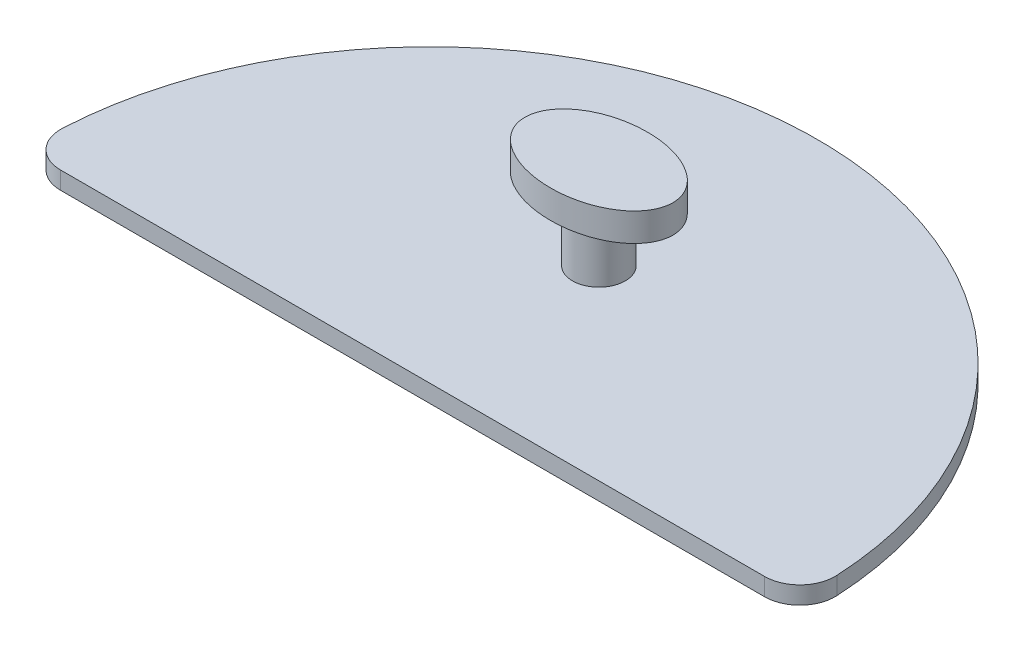
from build123d import *

# Parameters (mm, degrees)
EXTRUDE_1_DEPTH = 5
EXTRUDE_2_DEPTH = 5
SKETCH_3_R      = 7.5
EXTRUDE_3_DEPTH = 18
SKETCH_4_RX     = 21.017833777
SKETCH_4_RY     = 13.757127563
EXTRUDE_4_DEPTH = 8
FILLET_3_R      = 10


with BuildPart() as part:
    # 草图1 → 凸台-拉伸1 (new body)
    with BuildSketch(Plane(origin=(0, 0, 0), x_dir=(1, 0, 0), z_dir=(0, 1, 0))):
        with BuildLine():
            Line((0, 0), (220, 0))
            ThreePointArc((220, 0), (110, 115), (0, 0))
        make_face()
    extrude(amount=EXTRUDE_1_DEPTH)

    # 草图2 → 凸台-拉伸2 (add)
    with BuildSketch(Plane(origin=(0, 0, 0), x_dir=(1, 0, 0), z_dir=(0, 1, 0))):
        with BuildLine():
            Line((21.644037619, 15.811734656), (196.03994764, 15.811734656))
            ThreePointArc((196.03994764, 15.811734656), (108.841992629, 92.042683628), (21.644037619, 15.811734656))
        make_face()
    extrude(amount=-EXTRUDE_2_DEPTH)

    # 草图3 → 凸台-拉伸3 (add)
    with BuildSketch(Plane(origin=(0, 5, 0), x_dir=(1, 0, 0), z_dir=(0, 1, 0))):
        with Locations((110, 52.914290812)):
            Circle(SKETCH_3_R)
    extrude(amount=EXTRUDE_3_DEPTH)

    # 草图4 → 凸台-拉伸4 (add)
    with BuildSketch(Plane(origin=(0, 23, 0), x_dir=(1, 0, 0), z_dir=(0, 1, 0))):
        with Locations((110, 52.914290812)):
            Ellipse(SKETCH_4_RX, SKETCH_4_RY)
    extrude(amount=EXTRUDE_4_DEPTH)

    # 圆角3
    fillet_3_edges = [part.edges().sort_by_distance(p)[0] for p in [
        (220, 2.5, 0),
        (0, 2.5, 0),
    ]]
    fillet(fillet_3_edges, radius=FILLET_3_R)


solid = part.part
